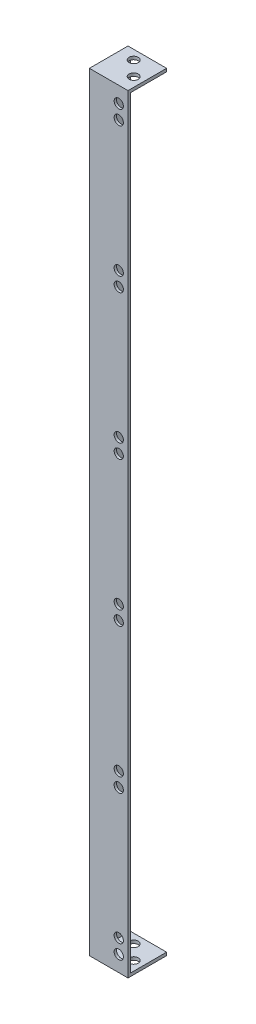
from build123d import *

# Parameters (mm, degrees)
BOSS_EXTRUDE1_DEPTH = 327
SKETCH2_R           = 1.95
CUT_EXTRUDE1_DEPTH  = 2
SKETCH3_R           = 1.95
CUT_EXTRUDE2_DEPTH  = 2
SKETCH5_W           = 16.3
SKETCH5_H           = 1.3
CUT_EXTRUDE4_DEPTH  = 20
SKETCH6_W           = 16.3
SKETCH6_H           = 16.3
BOSS_EXTRUDE3_DEPTH = 1.3
SKETCH7_W           = 16.3
SKETCH7_H           = 16.3
BOSS_EXTRUDE4_DEPTH = 1.3
SKETCH8_R           = 1.95
CUT_EXTRUDE7_DEPTH  = 350


with BuildPart() as part:
    # Sketch1 → Boss-Extrude1 (new body)
    with BuildSketch(Plane(origin=(0, 0, 0), x_dir=(1, 0, 0), z_dir=(0, 1, 0))):
        Polygon((0, 0), (0, 16.3), (1, 16.3), (1, 1), (16.3, 1), (16.3, 0), align=None)
    extrude(amount=BOSS_EXTRUDE1_DEPTH)

    # Sketch2 → Cut-Extrude1 (cut)
    with BuildSketch(Plane.XY):
        with Locations((12.4, 319)):
            Circle(SKETCH2_R)
        with Locations((12.4, 313)):
            Circle(SKETCH2_R)
        with Locations((12.4, 258)):
            Circle(SKETCH2_R)
        with Locations((12.4, 252)):
            Circle(SKETCH2_R)
        with Locations((12.4, 197)):
            Circle(SKETCH2_R)
        with Locations((12.4, 191)):
            Circle(SKETCH2_R)
        with Locations((12.4, 136)):
            Circle(SKETCH2_R)
        with Locations((12.4, 130)):
            Circle(SKETCH2_R)
        with Locations((12.4, 75)):
            Circle(SKETCH2_R)
        with Locations((12.4, 69)):
            Circle(SKETCH2_R)
        with Locations((12.4, 14)):
            Circle(SKETCH2_R)
        with Locations((12.4, 8)):
            Circle(SKETCH2_R)
    extrude(amount=-CUT_EXTRUDE1_DEPTH, mode=Mode.SUBTRACT)

    # Sketch3 → Cut-Extrude2 (cut)
    with BuildSketch(Plane.ZY):
        with Locations((-12.4, 319)):
            Circle(SKETCH3_R)
        with Locations((-12.4, 313)):
            Circle(SKETCH3_R)
        with Locations((-12.4, 258)):
            Circle(SKETCH3_R)
        with Locations((-12.4, 252)):
            Circle(SKETCH3_R)
        with Locations((-12.4, 197)):
            Circle(SKETCH3_R)
        with Locations((-12.4, 191)):
            Circle(SKETCH3_R)
        with Locations((-12.4, 136)):
            Circle(SKETCH3_R)
        with Locations((-12.4, 130)):
            Circle(SKETCH3_R)
        with Locations((-12.4, 75)):
            Circle(SKETCH3_R)
        with Locations((-12.4, 69)):
            Circle(SKETCH3_R)
        with Locations((-12.4, 14)):
            Circle(SKETCH3_R)
        with Locations((-12.4, 8)):
            Circle(SKETCH3_R)
    extrude(amount=-CUT_EXTRUDE2_DEPTH, mode=Mode.SUBTRACT)

    # Sketch5 → Cut-Extrude4 (cut)
    with BuildSketch(Plane.ZY):
        with Locations((-8.15, 326.35)):
            Rectangle(SKETCH5_W, SKETCH5_H)
        with Locations((-8.15, 0.65)):
            Rectangle(SKETCH5_W, SKETCH5_H)
    extrude(amount=-CUT_EXTRUDE4_DEPTH, mode=Mode.SUBTRACT)

    # Sketch6 → Boss-Extrude3 (add)
    with BuildSketch(Plane(origin=(0, 325.7, 0), x_dir=(1, 0, 0), z_dir=(0, 1, 0))):
        with Locations((8.15, 8.15)):
            Rectangle(SKETCH6_W, SKETCH6_H)
    extrude(amount=-BOSS_EXTRUDE3_DEPTH)

    # Sketch7 → Boss-Extrude4 (add)
    with BuildSketch(Plane.XZ.offset(-1.3)):
        with Locations((8.15, -8.15)):
            Rectangle(SKETCH7_W, SKETCH7_H)
    extrude(amount=-BOSS_EXTRUDE4_DEPTH)

    # Sketch8 → Cut-Extrude7 (cut)
    with BuildSketch(Plane.XZ.offset(-1.3)):
        with Locations((12.4, -6.3)):
            Circle(SKETCH8_R)
        with Locations((6.3, -12.4)):
            Circle(SKETCH8_R)
    extrude(amount=-CUT_EXTRUDE7_DEPTH, mode=Mode.SUBTRACT)


solid = part.part
